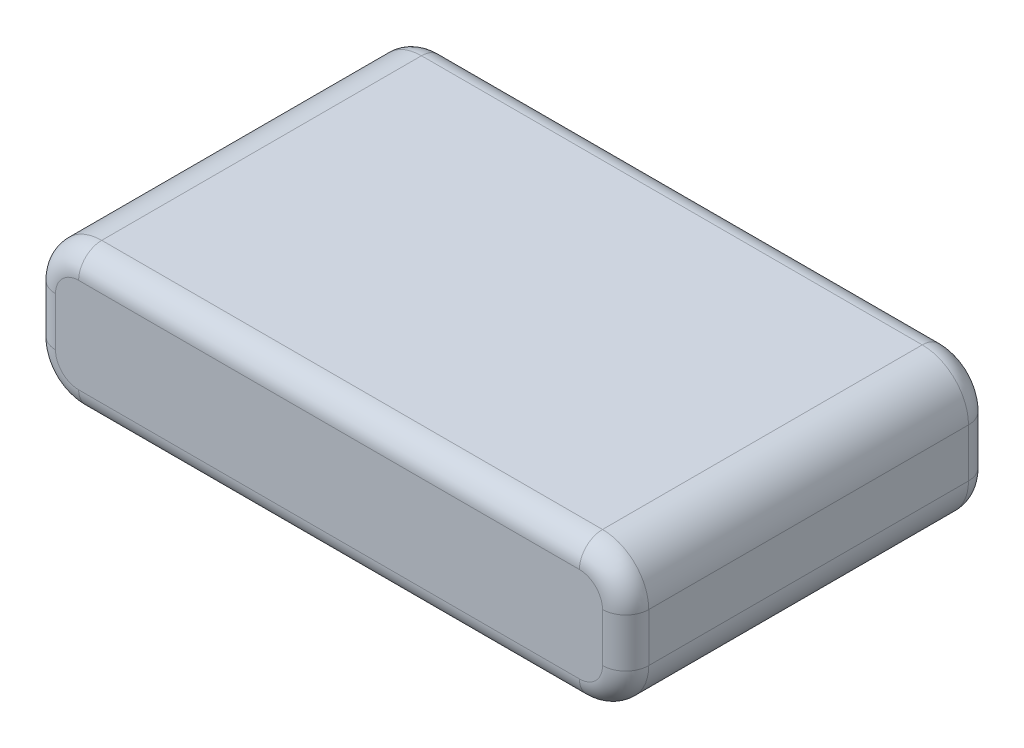
from build123d import *

# Parameters (mm, degrees)
SKETCH1_W           = 38.5
SKETCH1_H           = 23.75
BOSS_EXTRUDE1_DEPTH = 9.15
FILLET1_R           = 3
FILLET2_R           = 1.5


with BuildPart() as part:
    # Sketch1 → Boss-Extrude1 (new body)
    with BuildSketch(Plane(origin=(0, 0, 0), x_dir=(1, 0, 0), z_dir=(0, 1, 0))):
        Rectangle(SKETCH1_W, SKETCH1_H)
    extrude(amount=BOSS_EXTRUDE1_DEPTH)

    # Fillet1
    fillet1_edges = [part.edges().sort_by_distance(p)[0] for p in [
        (-19.25, 0, 0),
        (-19.25, 9.15, 0),
        (19.25, 0, 0),
        (19.25, 9.15, 0),
    ]]
    fillet(fillet1_edges, radius=FILLET1_R)

    # Fillet2
    fillet2_edges = [part.edges().sort_by_distance(p)[0] for p in [
        (18.371320344, 0.878679656, -11.875),
        (19.25, 4.575, -11.875),
        (18.371320344, 8.271320344, -11.875),
        (0, 9.15, -11.875),
        (-18.371320344, 8.271320344, -11.875),
        (-19.25, 4.575, -11.875),
        (-18.371320344, 0.878679656, -11.875),
        (0, 0, -11.875),
        (-18.371320344, 8.271320344, 11.875),
        (0, 9.15, 11.875),
        (18.371320344, 8.271320344, 11.875),
        (19.25, 4.575, 11.875),
        (18.371320344, 0.878679656, 11.875),
        (0, 0, 11.875),
        (-18.371320344, 0.878679656, 11.875),
        (-19.25, 4.575, 11.875),
    ]]
    fillet(fillet2_edges, radius=FILLET2_R)


solid = part.part
